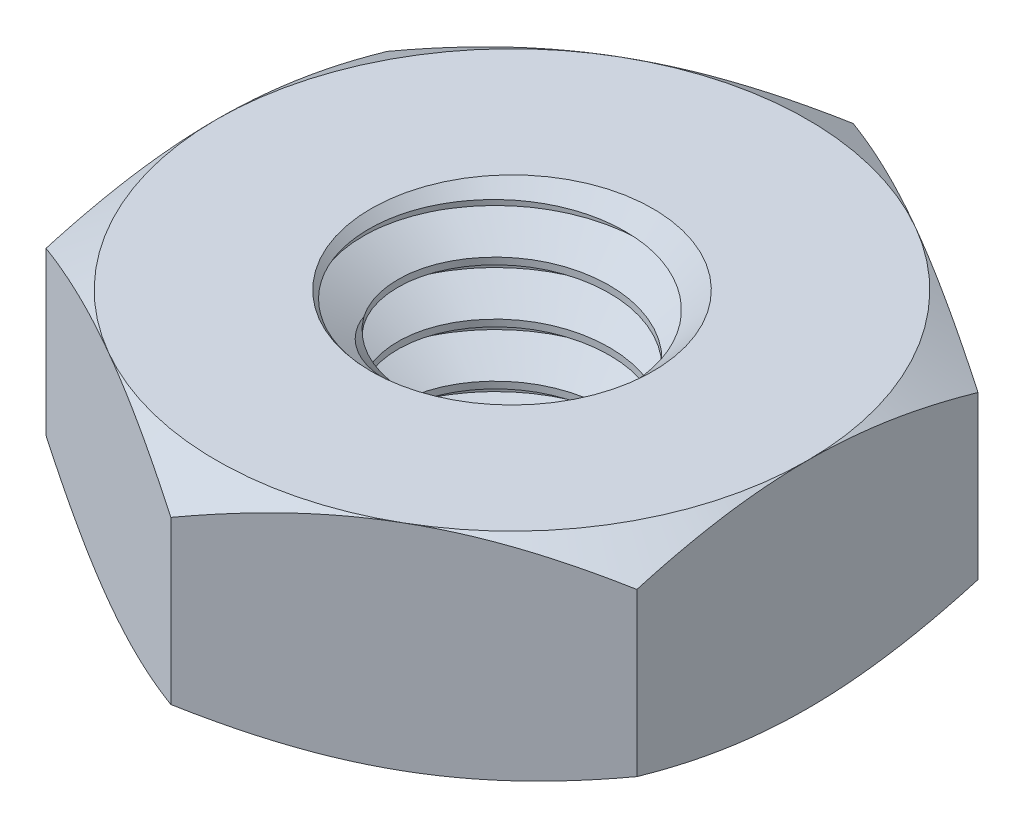
from build123d import *

# Parameters (mm, degrees)
SKETCH1_R               = 2.0828
BOSS_EXTRUDE1_DEPTH     = 1.5875
SKETCH5_OUTSIDE_W       = 42.524
SKETCH5_OUTSIDE_H       = 43.874
SKETCH5_OUTSIDE_R       = 4.365625
CUT_EXTRUDE2_DEPTH      = 8.385856901
CUT_EXTRUDE2_DRAFT      = -60
MIRROR1_COPY_1_SKETCH_W = 42.524
MIRROR1_COPY_1_SKETCH_H = 43.874
MIRROR1_COPY_1_SKETCH_R = 4.365625
MIRROR1_COPY_1_DEPTH    = 8.385856901
MIRROR1_COPY_1_DRAFT    = -60
SKETCH8_R               = 2.0828
BOSS_EXTRUDE2_DEPTH     = 3.175
BOSS_EXTRUDE3_START     = -3.175
SKETCH9_R               = 2.0828
BOSS_EXTRUDE3_DEPTH     = 3.175
CUT_SWEEP1_PITCH        = 0.79375


with BuildPart() as part:
    # Sketch1 → Boss-Extrude1 (new, symmetric)
    with BuildSketch(Plane(origin=(0, 0, 0), x_dir=(1, 0, 0), z_dir=(0, 1, 0))):
        Polygon((-4.365625, 2.520494769), (-4.365625, -2.520494769), (0, -5.040989538), (4.365625, -2.520494769), (4.365625, 2.520494769), (0, 5.040989538), align=None)
        with Locations(Location((0, 0, 0), (0, 0, 270))):
            Circle(SKETCH1_R, mode=Mode.SUBTRACT)
    extrude(amount=BOSS_EXTRUDE1_DEPTH, both=True)


with BuildPart() as cut_extrude2_tool:
    # Sketch5 outside → Cut-Extrude2 (with draft: the straight prism first)
    with BuildSketch(Plane(origin=(0, 1.5875, 0), x_dir=(1, 0, 0), z_dir=(0, 1, 0))):
        Rectangle(SKETCH5_OUTSIDE_W, SKETCH5_OUTSIDE_H)
        Circle(SKETCH5_OUTSIDE_R, mode=Mode.SUBTRACT)
    extrude(amount=-CUT_EXTRUDE2_DEPTH)
    # Cut-Extrude2: the draft: its side faces are tilted about the plane it starts from
    cut_extrude2_sides = [cut_extrude2_tool.faces().sort_by_distance(p)[0] for p in [
        (0, -2.60542845, 21.937),
        (21.262, -2.60542845, 0),
        (0, -2.60542845, -21.937),
        (-21.262, -2.60542845, 0),
        (-4.365625, -2.60542845, 0),
    ]]
    draft(cut_extrude2_sides, Plane(origin=(0, 1.5875, 0), x_dir=(1, 0, 0), z_dir=(0, 1, 0)), CUT_EXTRUDE2_DRAFT)


with BuildPart() as part_1:
    add(part.part)

    # Cut-Extrude2: cut by cut_extrude2_tool
    add(cut_extrude2_tool.part, mode=Mode.SUBTRACT)


with BuildPart() as mirror1_copy_1_tool:
    # Mirror1 copy 1 sketch → Mirror1 copy 1 (with draft: the straight prism first)
    with BuildSketch(Plane.XZ.offset(1.5875)):
        Rectangle(MIRROR1_COPY_1_SKETCH_W, MIRROR1_COPY_1_SKETCH_H)
        Circle(MIRROR1_COPY_1_SKETCH_R, mode=Mode.SUBTRACT)
    extrude(amount=-MIRROR1_COPY_1_DEPTH)
    # Mirror1 copy 1: the draft: its side faces are tilted about the plane it starts from
    mirror1_copy_1_sides = [mirror1_copy_1_tool.faces().sort_by_distance(p)[0] for p in [
        (0, 2.60542845, 21.937),
        (21.262, 2.60542845, 0),
        (0, 2.60542845, -21.937),
        (-21.262, 2.60542845, 0),
        (-4.365625, 2.60542845, 0),
    ]]
    draft(mirror1_copy_1_sides, Plane.XZ.offset(1.5875), MIRROR1_COPY_1_DRAFT)


with BuildPart() as part_2:
    add(part_1.part)

    # Mirror1 copy 1: cut by mirror1_copy_1_tool
    add(mirror1_copy_1_tool.part, mode=Mode.SUBTRACT)

    # Sketch9 → Boss-Extrude3 (add)
    with BuildSketch(Plane(origin=(0, 1.5875, 0), x_dir=(1, 0, 0), z_dir=(0, 1, 0)).offset(BOSS_EXTRUDE3_START)):
        with Locations(Location((0, 0, 0), (0, 0, 270))):
            Circle(SKETCH9_R)
    extrude(amount=BOSS_EXTRUDE3_DEPTH)


with BuildPart() as body_2:
    # Sketch8 → Boss-Extrude2 (new body)
    with BuildSketch(Plane(origin=(0, 1.5875, 0), x_dir=(1, 0, 0), z_dir=(0, 1, 0))):
        with Locations(Location((0, 0, 0), (0, 0, 270))):
            Circle(SKETCH8_R)
    extrude(amount=-BOSS_EXTRUDE2_DEPTH)

    # Cut-Sweep1: the profile of Sketch11 profile screwed along a right-hand helix of 5 turns, 8 arcs to a turn; built about Z, then put on its axis
    cut_sweep1_z = Axis((0, 0, 0), (0, 0, 1))
    cut_sweep1_corners = [(2.0831, 0, 0.000173205), (2.0831, 0, -0.694704455), (1.567244252, 0, -0.396875), (1.567244252, 0, -0.29765625)]
    with BuildLine(mode=Mode.PRIVATE) as cut_sweep1_profile:
        Line(cut_sweep1_corners[0], cut_sweep1_corners[1])
        Line(cut_sweep1_corners[1], cut_sweep1_corners[2])
        Line(cut_sweep1_corners[2], cut_sweep1_corners[3])
        Line(cut_sweep1_corners[3], cut_sweep1_corners[0])
    cut_sweep1_cap = Face(cut_sweep1_profile.wire())
    cut_sweep1_turn_angles = [0, 22.5, 45, 67.5, 90, 112.5, 135, 157.5, 180, 202.5, 225, 247.5, 270, 292.5, 315, 337.5, 360]
    cut_sweep1_turn_weights = [1, 0.9238795325112867, 1, 0.9238795325112867, 1, 0.9238795325112867, 1, 0.9238795325112867, 1, 0.9238795325112867, 1, 0.9238795325112867, 1, 0.9238795325112867, 1, 0.9238795325112867, 1]
    cut_sweep1_turn_rails = [Edge.make_bspline([Vector(p[0], p[1], 0).rotate(cut_sweep1_z, cut_sweep1_turn_angles[k]) / cut_sweep1_turn_weights[k] + Vector(0, 0, p[2] + CUT_SWEEP1_PITCH * cut_sweep1_turn_angles[k] / 360) for k in range(17)], [0, 0, 0, 1, 1, 2, 2, 3, 3, 4, 4, 5, 5, 6, 6, 7, 7, 8, 8, 8], 2, cut_sweep1_turn_weights) for p in cut_sweep1_corners]
    cut_sweep1_turn_sides = [Face.make_surface_from_curves(cut_sweep1_turn_rails[p[0]], cut_sweep1_turn_rails[p[1]]) for p in [(0, 1), (1, 2), (2, 3), (3, 0)]]
    cut_sweep1 = Plane(origin=(0, 1.5875, 0), x_dir=(0, 0, 1), z_dir=(0, -1, 0)) * Solid(Shell([*[p.moved(Location((0, 0, CUT_SWEEP1_PITCH * i))) for i in range(5) for p in cut_sweep1_turn_sides], cut_sweep1_cap, cut_sweep1_cap.rotate(cut_sweep1_z, 1800).moved(Location((0, 0, CUT_SWEEP1_PITCH * 1800 / 360)))]))
    add(cut_sweep1, mode=Mode.SUBTRACT)


with BuildPart() as part_3:
    add(part_2.part)

    # Combine1: cut body 2
    add(body_2.part, mode=Mode.SUBTRACT)

    # Cut-Extrude3 cone 1 section (through the dimple's axis) → Cut-Extrude3 (revolve, cut)
    with BuildSketch(Plane(origin=(0, 1.5875, 0), x_dir=(0, 0, 1), z_dir=(1, 0, 0))):
        Polygon((0, 0), (2.0828, 0), (0, 2.0828), align=None)
    revolve(axis=Axis((0, 1.5875, 0), (0, -1, 0)), mode=Mode.SUBTRACT)

    # Cut-Extrude4 cone 1 section (through the dimple's axis) → Cut-Extrude4 (revolve, cut)
    with BuildSketch(Plane(origin=(0, -1.5875, 0), x_dir=(0, 0, -1), z_dir=(1, 0, 0))):
        Polygon((0, 0), (2.0828, 0), (0, 2.0828), align=None)
    revolve(axis=Axis((0, -1.5875, 0), (0, 1, 0)), mode=Mode.SUBTRACT)


solid = part_3.part
